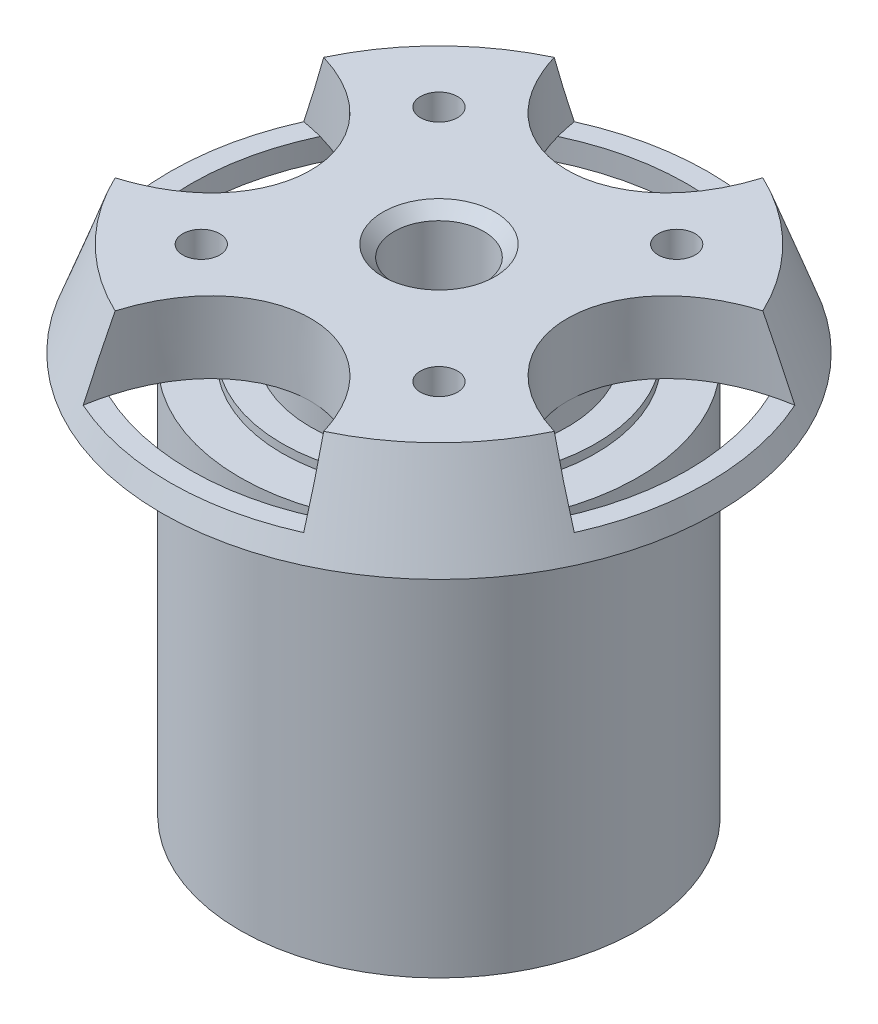
from build123d import *

# Parameters (mm, degrees)
TAP_DRILL_FOR_M4X0_7_TAP1_D     = 3.3
TAP_DRILL_FOR_M4X0_7_TAP1_DEPTH = 8
TAP_DRILL_FOR_M4X0_7_TAP1_TIP   = 0.991420021
CHAMFER1_SIZE                   = 1
CUT_EXTRUDE3_DEPTH              = 52.479971834
CIRPATTERN2_COUNT               = 4
SKETCH9_R                       = 22.15
SKETCH9_R_2                     = 11.45
CUT_EXTRUDE5_DEPTH              = 2


with BuildPart() as part:
    # Sketch2 → Revolve1 (revolve)
    with BuildSketch(Plane.XY):
        Polygon((21.692650032, 0), (4, 0), (4, -44.15), (17.75, -44.15), (17.75, -9.15), (14, -9.15), (14, -8.4), (24.75, -8.4), align=None)
    revolve(axis=Axis((0, 46.5537, 0), (0, -1, 0)))

    # Tap Drill for M4x0.7 Tap1
    with Locations(Plane(origin=(0, 0, 0), x_dir=(1, 0, 0), z_dir=(0, 1, 0))):
        with Locations((10.606601718, -10.606601718), (-10.606601718, -10.606601718), (-10.606601718, 10.606601718), (10.606601718, 10.606601718)):
            Hole(TAP_DRILL_FOR_M4X0_7_TAP1_D / 2, depth=TAP_DRILL_FOR_M4X0_7_TAP1_DEPTH)
            with Locations((0, 0, -(TAP_DRILL_FOR_M4X0_7_TAP1_DEPTH + TAP_DRILL_FOR_M4X0_7_TAP1_TIP / 2))):  # 118° drill point
                Cone(0, TAP_DRILL_FOR_M4X0_7_TAP1_D / 2, TAP_DRILL_FOR_M4X0_7_TAP1_TIP, mode=Mode.SUBTRACT)

    # Chamfer1
    chamfer1_edges = [part.edges().sort_by_distance(p)[0] for p in [
        (-4, 0, 0),
    ]]
    chamfer(chamfer1_edges, length=CHAMFER1_SIZE)

    # Sketch8 → Cut-Extrude3 (cut, through all)
    with BuildSketch(Plane(origin=(0, -6.4, 0), x_dir=(-1, 0, 0), z_dir=(0, -1, 0))):
        with BuildLine():
            ThreePointArc((-9.95, -22.661862236), (0, -24.75), (9.95, -22.661862236))
            add(Edge.make_bspline(
                [(-9.95, -22.661862236), (-8.05, -7.712712588), (8.05, -7.712712588), (9.95, -22.661862236)],
                knots=[0, 0, 0, 0, 1, 1, 1, 1], degree=3))
        make_face()
    cut_extrude3 = extrude(amount=-CUT_EXTRUDE3_DEPTH, mode=Mode.SUBTRACT)

    # CirPattern2: Cut-Extrude3 ×4 about axis
    cirpattern2_axis = Axis((0, 46.5537, 0), (0, -1, 0))
    for i in range(1, CIRPATTERN2_COUNT):
        add(cut_extrude3.rotate(cirpattern2_axis, i * 360 / CIRPATTERN2_COUNT), mode=Mode.SUBTRACT)

    # Sketch9 → Cut-Extrude5 (cut)
    with BuildSketch(Plane(origin=(0, -6.4, 0), x_dir=(1, 0, 0), z_dir=(0, 1, 0))):
        Circle(SKETCH9_R)
        Circle(SKETCH9_R_2, mode=Mode.SUBTRACT)
    extrude(amount=-CUT_EXTRUDE5_DEPTH, mode=Mode.SUBTRACT)


solid = part.part
